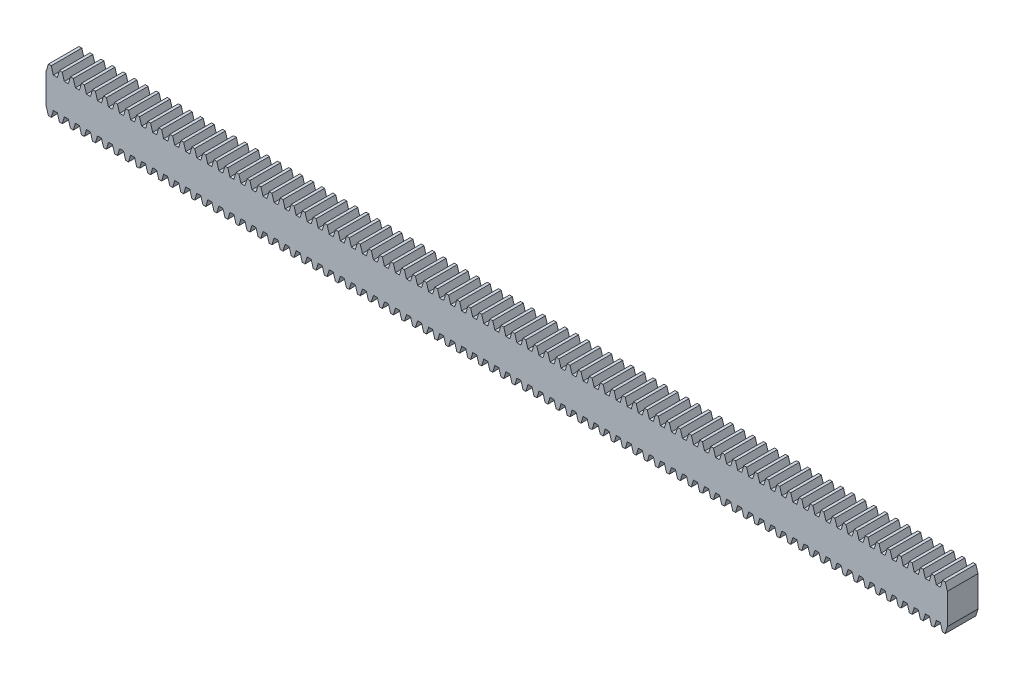
from build123d import *

# Parameters (mm, degrees)
SKETCH1_W           = 383
SKETCH1_H           = 13
BOSS_EXTRUDE1_DEPTH = 13
BOSS_EXTRUDE3_DEPTH = 13
LPATTERN1_COUNT     = 82
LPATTERN1_PITCH     = 4.69
SKETCH4_W           = 375
SKETCH4_H           = 9
CUT_EXTRUDE1_DEPTH  = 8


with BuildPart() as part:
    # Sketch1 → Boss-Extrude1 (new body)
    with BuildSketch(Plane.XY):
        Rectangle(SKETCH1_W, SKETCH1_H)
    extrude(amount=BOSS_EXTRUDE1_DEPTH)

    # Sketch2 → Boss-Extrude3 (add)
    with BuildSketch(Plane(origin=(0, 0, 0), x_dir=(-1, 0, 0), z_dir=(0, 0, -1))):
        Polygon((-191.5, 6.5), (-190.6, 9.5), (-189.4, 9.5), (-188.5, 6.5), align=None)
        Polygon((-188.5, -6.5), (-191.5, -6.5), (-190.6, -9.5), (-189.4, -9.5), align=None)
    boss_extrude3 = extrude(amount=-BOSS_EXTRUDE3_DEPTH)

    # LPattern1: Boss-Extrude3 ×82
    with Locations(*[(-i * LPATTERN1_PITCH, 0, 0) for i in range(1, LPATTERN1_COUNT)]):
        add(boss_extrude3)

    # Sketch4 → Cut-Extrude1 (cut)
    with BuildSketch(Plane(origin=(0, 0, 0), x_dir=(-1, 0, 0), z_dir=(0, 0, -1))):
        Rectangle(SKETCH4_W, SKETCH4_H)
    extrude(amount=-CUT_EXTRUDE1_DEPTH, mode=Mode.SUBTRACT)


solid = part.part
